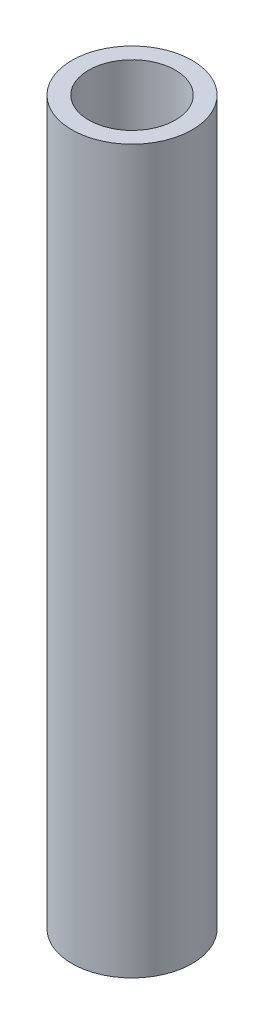
from build123d import *

# Parameters (mm, degrees)
SKETCH1_R           = 3.175
SKETCH1_R_2         = 2.286
BOSS_EXTRUDE1_DEPTH = 38.1


with BuildPart() as part:
    # Sketch1 → Boss-Extrude1 (new body)
    with BuildSketch(Plane(origin=(0, 0, 0), x_dir=(1, 0, 0), z_dir=(0, 1, 0))):
        Circle(SKETCH1_R)
        Circle(SKETCH1_R_2, mode=Mode.SUBTRACT)
    extrude(amount=BOSS_EXTRUDE1_DEPTH)


solid = part.part
